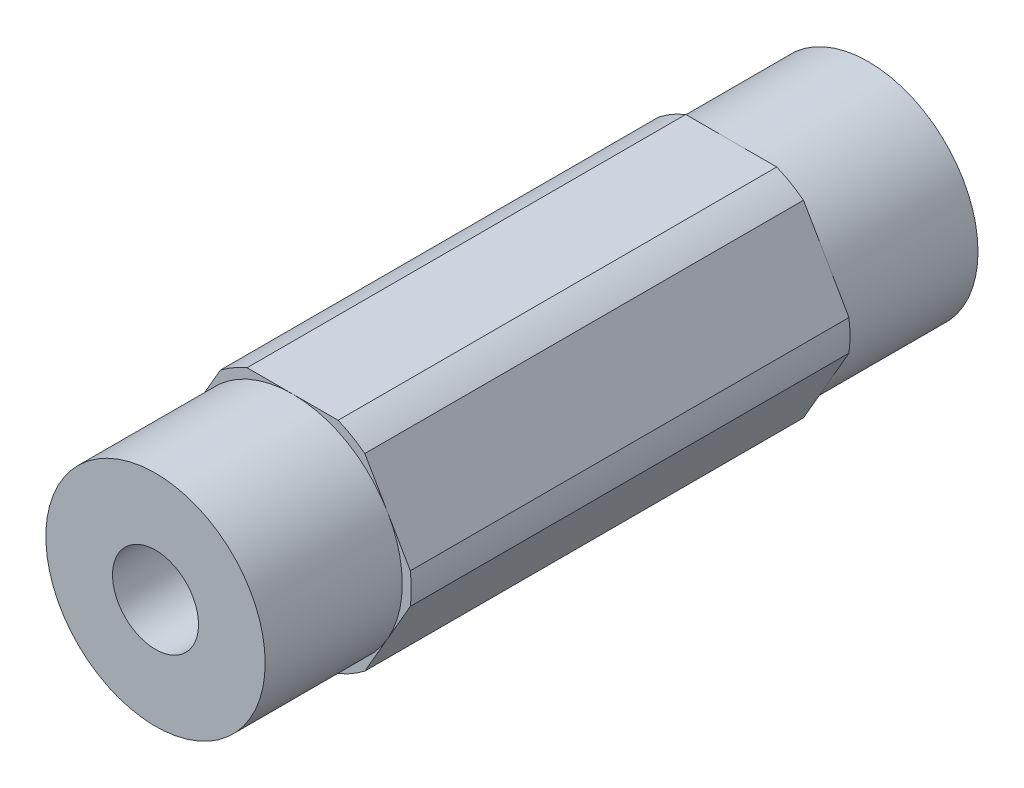
from build123d import *

# Parameters (mm, degrees)
SKETCH1_R           = 2.4892
BOSS_EXTRUDE1_DEPTH = 20.6375
SKETCH2_OUTSIDE_W   = 24.814
SKETCH2_OUTSIDE_H   = 23.764
SKETCH2_OUTSIDE_R   = 6.35
CUT_EXTRUDE4_DEPTH  = 7.9375


with BuildPart() as part:
    # Sketch1 → Boss-Extrude1 (new, symmetric)
    with BuildSketch(Plane.XY):
        with BuildLine():
            ThreePointArc((4.181770846, 5.456960429), (3.437499983, 5.953924622), (2.634980936, 6.35))
            Line((2.634980936, 6.35), (-2.634980936, 6.35))
            ThreePointArc((-2.634980936, 6.35), (-3.437499983, 5.953924622), (-4.181770846, 5.456960429))
            Line((-4.181770846, 5.456960429), (-6.816751782, 0.893039571))
            ThreePointArc((-6.816751782, 0.893039571), (-6.874999966, 0), (-6.816751782, -0.893039571))
            Line((-6.816751782, -0.893039571), (-4.181770846, -5.456960429))
            ThreePointArc((-4.181770846, -5.456960429), (-3.437499983, -5.953924622), (-2.634980936, -6.35))
            Line((-2.634980936, -6.35), (2.634980936, -6.35))
            ThreePointArc((2.634980936, -6.35), (3.437499983, -5.953924622), (4.181770846, -5.456960429))
            Line((4.181770846, -5.456960429), (6.816751782, -0.893039571))
            ThreePointArc((6.816751782, -0.893039571), (6.860422465, -0.447468582), (6.874999966, 0))
            ThreePointArc((6.874999966, 0), (6.860422465, 0.447468582), (6.816751782, 0.893039571))
            Line((6.816751782, 0.893039571), (4.181770846, 5.456960429))
        make_face()
        Circle(SKETCH1_R, mode=Mode.SUBTRACT)
    extrude(amount=BOSS_EXTRUDE1_DEPTH, both=True)

    # Sketch2 outside → Cut-Extrude4 (cut)
    with BuildSketch(Plane.XY.offset(20.6375)):
        Rectangle(SKETCH2_OUTSIDE_W, SKETCH2_OUTSIDE_H)
        Circle(SKETCH2_OUTSIDE_R, mode=Mode.SUBTRACT)
    cut_extrude4 = extrude(amount=-CUT_EXTRUDE4_DEPTH, mode=Mode.SUBTRACT)

    # Mirror1: Cut-Extrude4 across plane
    add(cut_extrude4.mirror(Plane.XY), mode=Mode.SUBTRACT)


solid = part.part
